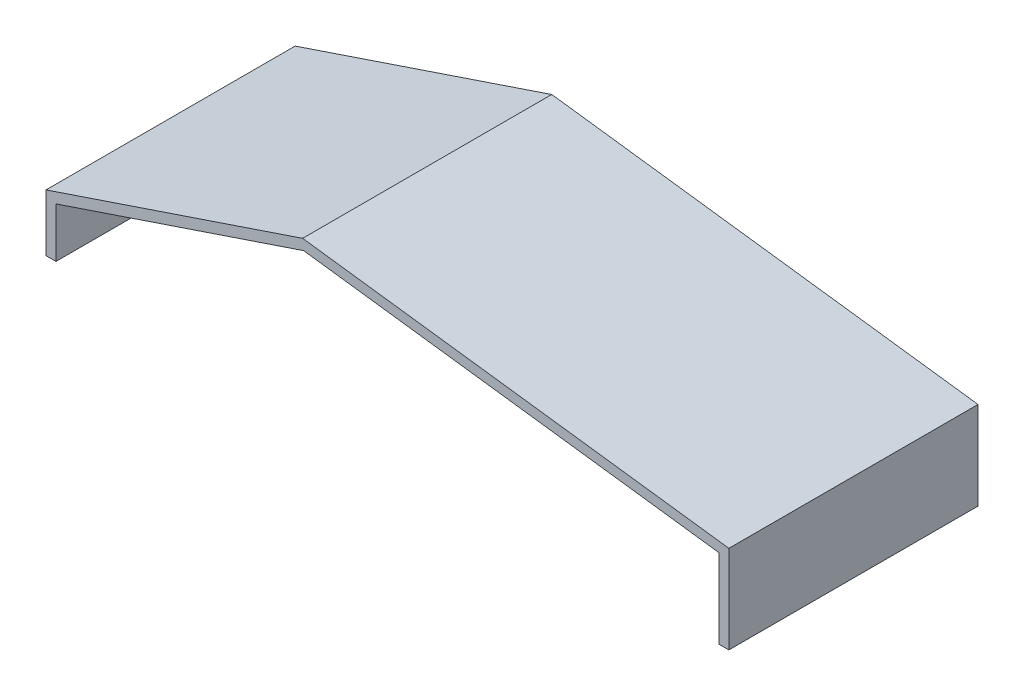
from build123d import *

# Parameters (mm, degrees)
BOSS_EXTRUDE2_DEPTH = 50


with BuildPart() as part:
    # Sketch1 → Boss-Extrude2 (new body)
    with BuildSketch(Plane.XY):
        Polygon((100, 4.545158411), (37.581362682, 12.649273189), (0, 0), (-12.125253501, -4.081162392), (-12.125253501, -14.081162392), (-14.125253501, -14.081162392), (-14.125253501, -2.644079928), (37.380977905, 14.69207676), (122.927337812, 3.585177453), (122.927337812, -2.644079928), (122.927337812, -14.081162392), (120.927337812, -14.081162392), (120.927337812, -2.644079928), (120.927337812, 1.828060523), align=None)
    extrude(amount=BOSS_EXTRUDE2_DEPTH)


solid = part.part
